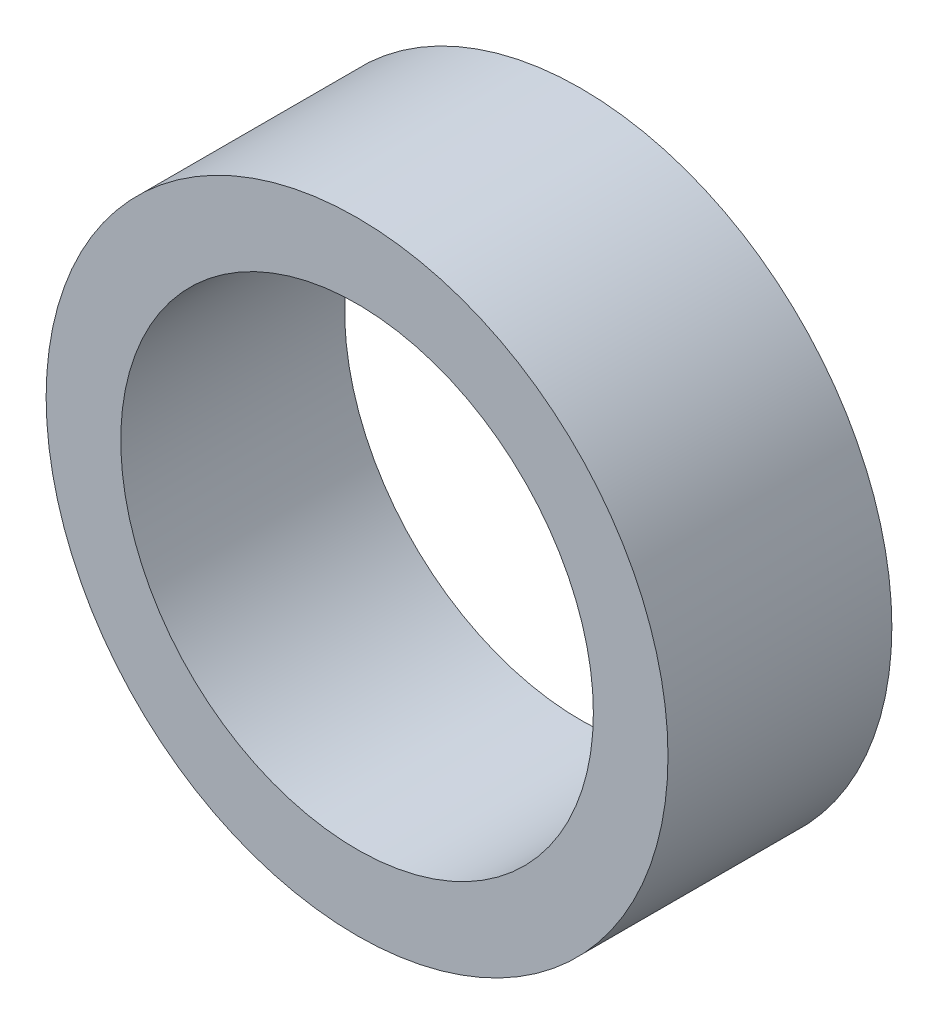
from build123d import *

# Parameters (mm, degrees)
SKETCH_1_R      = 2.5
SKETCH_1_R_2    = 1.9
EXTRUDE_1_DEPTH = 1.8


with BuildPart() as part:
    # ｽｹｯﾁ1 → ﾎﾞｽ - 押し出し1 (new body)
    with BuildSketch(Plane.XY):
        Circle(SKETCH_1_R)
        Circle(SKETCH_1_R_2, mode=Mode.SUBTRACT)
    extrude(amount=EXTRUDE_1_DEPTH)


solid = part.part
